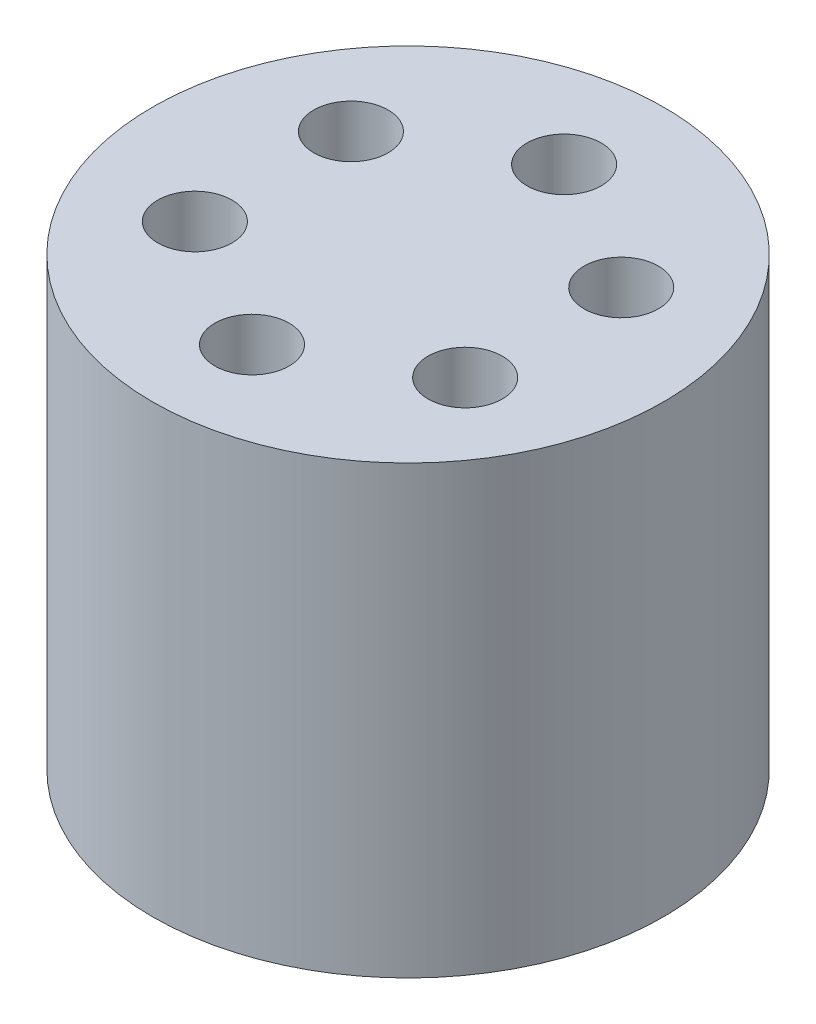
from build123d import *

# Parameters (mm, degrees)
SKETCH1_R           = 18.9
BOSS_EXTRUDE1_DEPTH = 33
SKETCH2_R           = 2.75
CUT_EXTRUDE1_DEPTH  = 91.4


with BuildPart() as part:
    # Sketch1 → Boss-Extrude1 (new body)
    with BuildSketch(Plane(origin=(0, 0, 0), x_dir=(1, 0, 0), z_dir=(0, 1, 0))):
        Circle(SKETCH1_R)
    extrude(amount=BOSS_EXTRUDE1_DEPTH)

    # Sketch2 → Cut-Extrude1 (cut)
    with BuildSketch(Plane(origin=(0, 33, 0), x_dir=(1, 0, 0), z_dir=(0, 1, 0))):
        with Locations((0, 11.547005384)):
            Circle(SKETCH2_R)
        with Locations((-10, 5.773502692)):
            Circle(SKETCH2_R)
        with Locations((10, 5.773502692)):
            Circle(SKETCH2_R)
        with Locations((-10, -5.773502692)):
            Circle(SKETCH2_R)
        with Locations((10, -5.773502692)):
            Circle(SKETCH2_R)
        with Locations((0, -11.547005384)):
            Circle(SKETCH2_R)
    extrude(amount=-CUT_EXTRUDE1_DEPTH, mode=Mode.SUBTRACT)


solid = part.part
